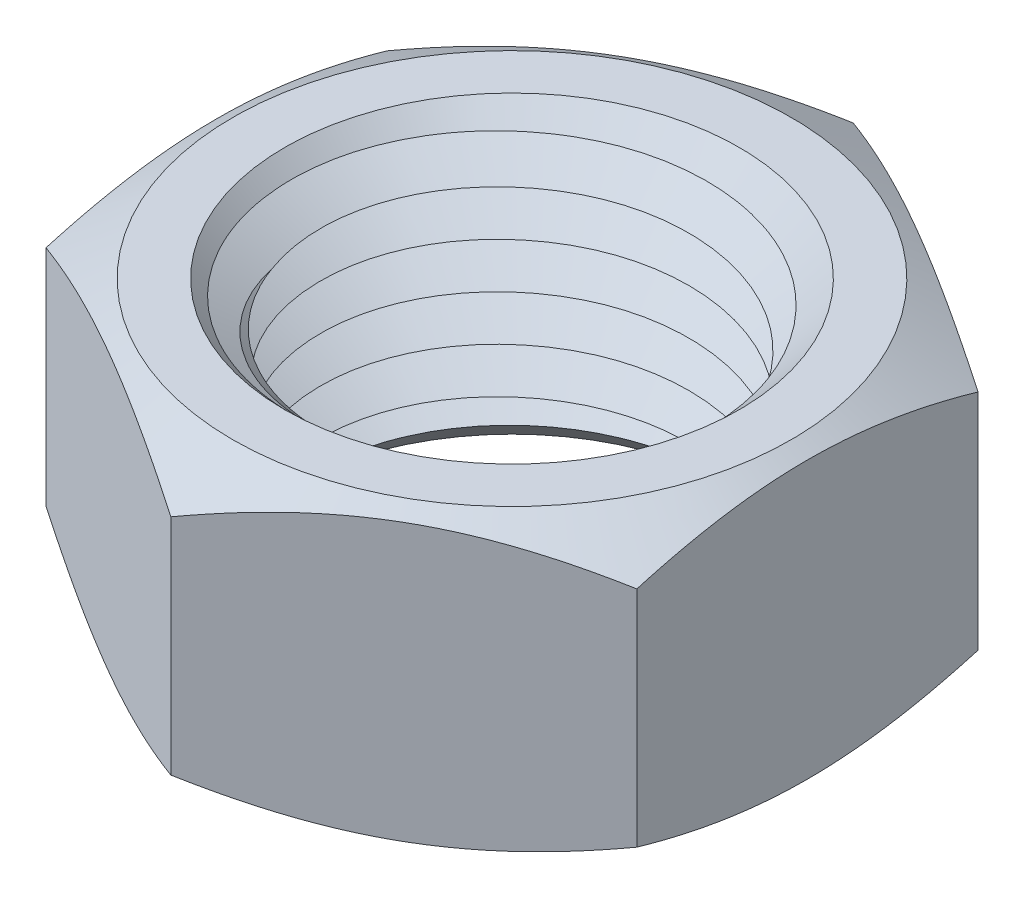
from build123d import *

# Parameters (mm, degrees)
ESBO_O1_R                 = 4
EXTRUS_O1_DEPTH           = 6.5
ESBO_O2_OUTSIDE_W         = 22.644
ESBO_O2_OUTSIDE_H         = 24.656
ESBO_O2_OUTSIDE_R         = 6.143006877
EXTRUS_O2_DEPTH           = 1
EXTRUS_O2_DRAFT           = -60
ESBO_O3_OUTSIDE_W         = 22.644
ESBO_O3_OUTSIDE_H         = 24.656
ESBO_O3_OUTSIDE_R         = 6.134114902
EXTRUS_O3_DEPTH           = 1
EXTRUS_O3_DRAFT           = -60
CHANFRO1_SIZE             = 1
VARREDURA_DE_CORTE2_PITCH = 1


with BuildPart() as part:
    # Esboço1 → Extrusão1 (new body)
    with BuildSketch(Plane(origin=(0, 0, 0), x_dir=(1, 0, 0), z_dir=(0, 1, 0))):
        Polygon((0, 7.505553499), (-6.5, 3.75277675), (-6.5, -3.75277675), (0, -7.505553499), (6.5, -3.75277675), (6.5, 3.75277675), align=None)
        with Locations(Location((0, 0, 0), (0, 0, 270))):
            Circle(ESBO_O1_R, mode=Mode.SUBTRACT)
    extrude(amount=-EXTRUS_O1_DEPTH)


with BuildPart() as extrus_o2_tool:
    # Esboço2 outside → Extrusão2 (with draft: the straight prism first)
    with BuildSketch(Plane(origin=(0, 0, 0), x_dir=(1, 0, 0), z_dir=(0, 1, 0))):
        Rectangle(ESBO_O2_OUTSIDE_W, ESBO_O2_OUTSIDE_H)
        Circle(ESBO_O2_OUTSIDE_R, mode=Mode.SUBTRACT)
    extrude(amount=-EXTRUS_O2_DEPTH)
    # Extrusão2: the draft: its side faces are tilted about the plane it starts from
    extrus_o2_sides = [extrus_o2_tool.faces().sort_by_distance(p)[0] for p in [
        (0, -0.5, 12.328),
        (11.322, -0.5, 0),
        (0, -0.5, -12.328),
        (-11.322, -0.5, 0),
        (-6.143006877, -0.5, 0),
    ]]
    draft(extrus_o2_sides, Plane(origin=(0, 0, 0), x_dir=(1, 0, 0), z_dir=(0, 1, 0)), EXTRUS_O2_DRAFT)


with BuildPart() as part_1:
    add(part.part)

    # Extrusão2: cut by extrus_o2_tool
    add(extrus_o2_tool.part, mode=Mode.SUBTRACT)


with BuildPart() as extrus_o3_tool:
    # Esboço3 outside → Extrusão3 (with draft: the straight prism first)
    with BuildSketch(Plane.XZ.offset(6.5)):
        Rectangle(ESBO_O3_OUTSIDE_W, ESBO_O3_OUTSIDE_H)
        Circle(ESBO_O3_OUTSIDE_R, mode=Mode.SUBTRACT)
    extrude(amount=-EXTRUS_O3_DEPTH)
    # Extrusão3: the draft: its side faces are tilted about the plane it starts from
    extrus_o3_sides = [extrus_o3_tool.faces().sort_by_distance(p)[0] for p in [
        (0, -6, -12.328),
        (11.322, -6, 0),
        (0, -6, 12.328),
        (-11.322, -6, 0),
        (-6.134114902, -6, 0),
    ]]
    draft(extrus_o3_sides, Plane.XZ.offset(6.5), EXTRUS_O3_DRAFT)


with BuildPart() as part_2:
    add(part_1.part)

    # Extrusão3: cut by extrus_o3_tool
    add(extrus_o3_tool.part, mode=Mode.SUBTRACT)

    # Chanfro1
    chanfro1_edges = [part_2.edges().sort_by_distance(p)[0] for p in [
        (0, -6.5, -4),
        (0, 0, -4),
    ]]
    chamfer(chanfro1_edges, length=CHANFRO1_SIZE)

    # Varredura de corte2: the profile of Esboço5 screwed along a right-hand helix of 6.5 turns, 6 arcs to a turn; built about Z, then put on its axis
    varredura_de_corte2_z = Axis((0, 0, 0), (0, 0, 1))
    varredura_de_corte2_corners = [(3.97, 0, 0.051961524), (3.97, 0, -1.051961524), (4.926025404, 0, -0.5)]
    with BuildLine(mode=Mode.PRIVATE) as varredura_de_corte2_profile:
        Line(varredura_de_corte2_corners[0], varredura_de_corte2_corners[1])
        Line(varredura_de_corte2_corners[1], varredura_de_corte2_corners[2])
        Line(varredura_de_corte2_corners[2], varredura_de_corte2_corners[0])
    varredura_de_corte2_cap = Face(varredura_de_corte2_profile.wire())
    varredura_de_corte2_turn_angles = [0, 30, 60, 90, 120, 150, 180, 210, 240, 270, 300, 330, 360]
    varredura_de_corte2_turn_weights = [1, 0.8660254037844387, 1, 0.8660254037844387, 1, 0.8660254037844387, 1, 0.8660254037844387, 1, 0.8660254037844387, 1, 0.8660254037844387, 1]
    varredura_de_corte2_turn_rails = [Edge.make_bspline([Vector(p[0], p[1], 0).rotate(varredura_de_corte2_z, varredura_de_corte2_turn_angles[k]) / varredura_de_corte2_turn_weights[k] + Vector(0, 0, p[2] + VARREDURA_DE_CORTE2_PITCH * varredura_de_corte2_turn_angles[k] / 360) for k in range(13)], [0, 0, 0, 1, 1, 2, 2, 3, 3, 4, 4, 5, 5, 6, 6, 6], 2, varredura_de_corte2_turn_weights) for p in varredura_de_corte2_corners]
    varredura_de_corte2_turn_sides = [Face.make_surface_from_curves(varredura_de_corte2_turn_rails[p[0]], varredura_de_corte2_turn_rails[p[1]]) for p in [(0, 1), (1, 2), (2, 0)]]
    varredura_de_corte2_turn = Solid(Shell([*varredura_de_corte2_turn_sides, varredura_de_corte2_cap, varredura_de_corte2_cap.rotate(varredura_de_corte2_z, 360).moved(Location((0, 0, VARREDURA_DE_CORTE2_PITCH * 360 / 360)))]))
    varredura_de_corte2_last_angles = [2160, 2190, 2220, 2250, 2280, 2310, 2340]
    varredura_de_corte2_last_weights = [1, 0.8660254037844387, 1, 0.8660254037844387, 1, 0.8660254037843891, 1]
    varredura_de_corte2_last_rails = [Edge.make_bspline([Vector(p[0], p[1], 0).rotate(varredura_de_corte2_z, varredura_de_corte2_last_angles[k]) / varredura_de_corte2_last_weights[k] + Vector(0, 0, p[2] + VARREDURA_DE_CORTE2_PITCH * varredura_de_corte2_last_angles[k] / 360) for k in range(7)], [0, 0, 0, 1, 1, 2, 2, 3, 3, 3], 2, varredura_de_corte2_last_weights) for p in varredura_de_corte2_corners]
    varredura_de_corte2_last_sides = [Face.make_surface_from_curves(varredura_de_corte2_last_rails[p[0]], varredura_de_corte2_last_rails[p[1]]) for p in [(0, 1), (1, 2), (2, 0)]]
    varredura_de_corte2_last = Solid(Shell([*varredura_de_corte2_last_sides, varredura_de_corte2_cap.rotate(varredura_de_corte2_z, 2160).moved(Location((0, 0, VARREDURA_DE_CORTE2_PITCH * 2160 / 360))), varredura_de_corte2_cap.rotate(varredura_de_corte2_z, 2340).moved(Location((0, 0, VARREDURA_DE_CORTE2_PITCH * 2340 / 360)))]))
    varredura_de_corte2_each = [*[varredura_de_corte2_turn.moved(Location((0, 0, VARREDURA_DE_CORTE2_PITCH * i))) for i in range(6)], varredura_de_corte2_last]
    add(Plane(origin=(0, 0, 0), x_dir=(-1, 0, 0), z_dir=(0, -1, 0)) * Compound([varredura_de_corte2_each[i] for i in range(0, 7, 2)]), mode=Mode.SUBTRACT)
    add(Plane(origin=(0, 0, 0), x_dir=(-1, 0, 0), z_dir=(0, -1, 0)) * Compound([varredura_de_corte2_each[i] for i in range(1, 7, 2)]), mode=Mode.SUBTRACT)


solid = part_2.part
